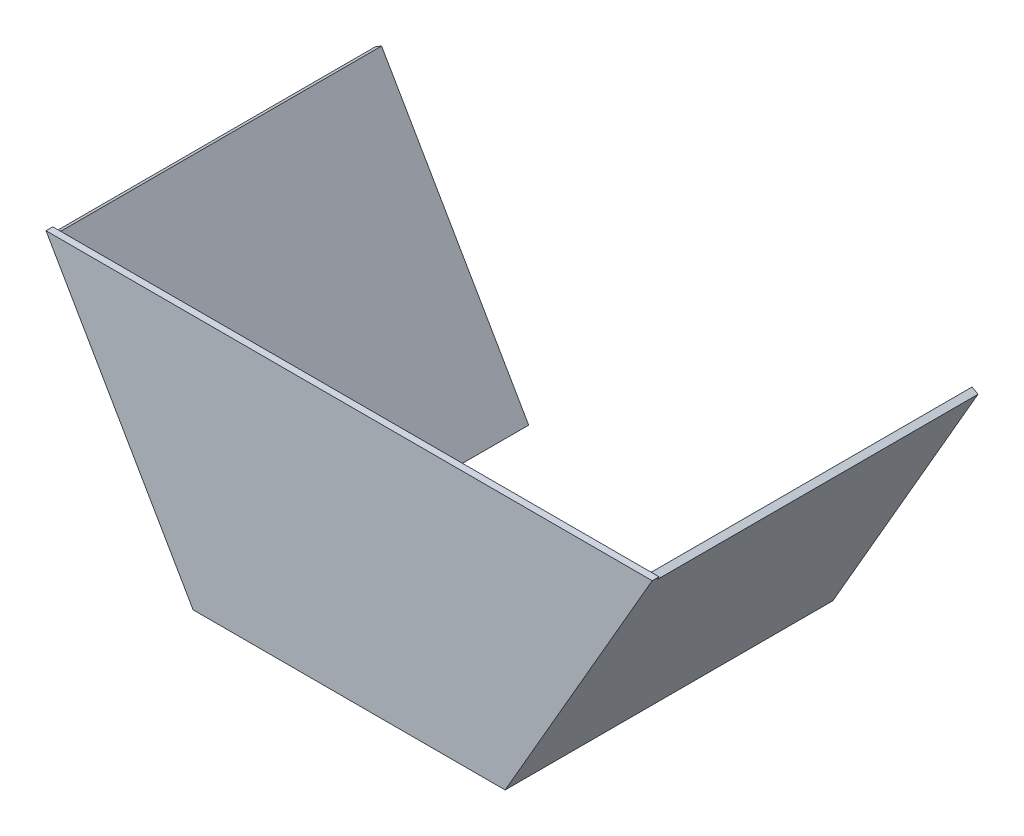
from build123d import *

# Parameters (mm, degrees)
BOSS_EXTRUDE1_DEPTH   = 300
BOSS_EXTRUDE1_2_DEPTH = 300
BOSS_EXTRUDE2_DEPTH   = 6.35


with BuildPart() as part:
    # Sketch1 → Boss-Extrude1 (new body)
    with BuildSketch(Plane.XY):
        Polygon((-138.5, 0), (-276, 238.156986041), (-281.499261314, 234.981986041), (-145.832348419, 0), align=None)
    extrude(amount=BOSS_EXTRUDE1_DEPTH)



with BuildPart() as body_2:
    # Sketch1 → Boss-Extrude1 2 (new body)
    with BuildSketch(Plane.XY):
        Polygon((138.5, 0), (276, 238.156986041), (281.499261314, 234.981986041), (145.832348419, 0), align=None)
    extrude(amount=BOSS_EXTRUDE1_2_DEPTH)


with BuildPart() as part_1:
    add(part.part)

    add(body_2.part)  # Boss-Extrude2 merges body 2
    # Sketch2 → Boss-Extrude2 (add)
    with BuildSketch(Plane.XY.offset(300)):
        Polygon((-145.832348419, 0), (-283.332348419, 238.156986041), (283.332348419, 238.156986041), (145.832348419, 0), align=None)
    extrude(amount=BOSS_EXTRUDE2_DEPTH)


solid = part_1.part
